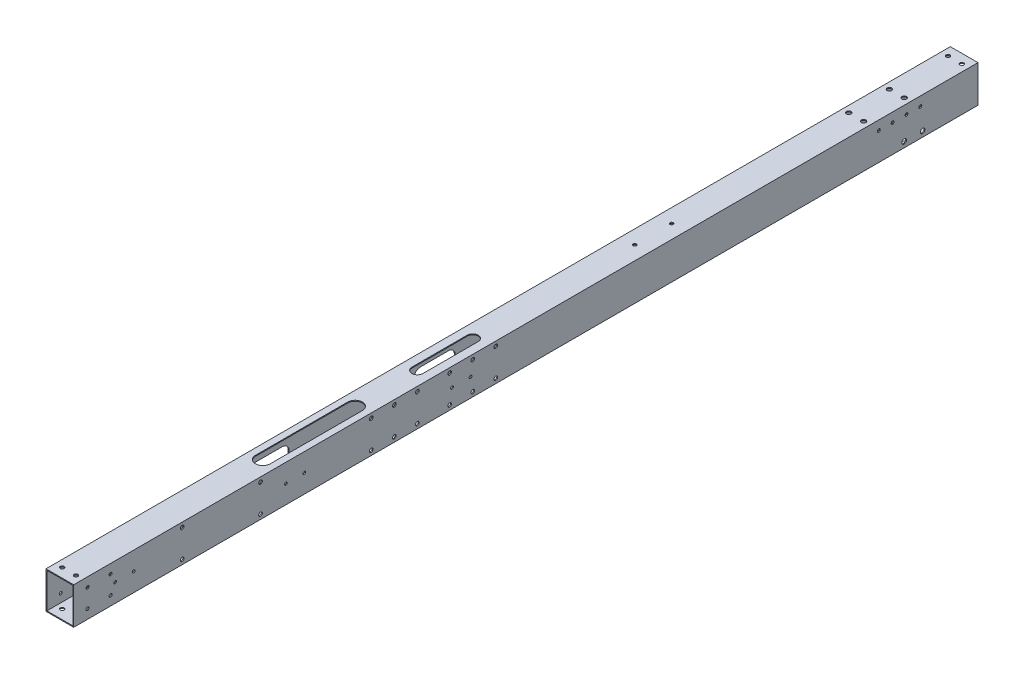
from build123d import *

# Parameters (mm, degrees)
SKETCH_1_W           = 30
SKETCH_1_H           = 40
SKETCH_1_W_2         = 28
SKETCH_1_H_2         = 38
EXTRUDE_1_DEPTH      = 940
SKETCH_5_R           = 2.5
CUT_EXTRUDE_3_DEPTH  = 941.97024395
CUT_EXTRUDE_4_DEPTH  = 1
SKETCH_7_R           = 1.5
CUT_EXTRUDE_5_DEPTH  = 1
SKETCH_17_W          = 30
SKETCH_17_H          = 40
SKETCH_17_W_2        = 28
SKETCH_17_H_2        = 38
EXTRUDE_2_DEPTH      = 20
SKETCH_18_W          = 30
SKETCH_18_H          = 40
SKETCH_18_W_2        = 28
SKETCH_18_H_2        = 38
EXTRUDE_3_DEPTH      = 20
SKETCH_19_R          = 2.1
CUT_EXTRUDE_16_DEPTH = 961.950050731
SKETCH_20_R          = 1.6
CUT_EXTRUDE_17_DEPTH = 961.67684473
SKETCH_21_R          = 2.5
SKETCH_21_R_2        = 1.6
CUT_EXTRUDE_18_DEPTH = 961.67684473
SKETCH_23_R          = 2.5
CUT_EXTRUDE_19_DEPTH = 961.950050731
SKETCH_24_R          = 4.5
CUT_EXTRUDE_20_DEPTH = 10
SKETCH_25_W          = 114.67616049
SKETCH_25_H          = 1154.562704257
CUT_EXTRUDE_21_DEPTH = 968.690549711
SKETCH_26_R          = 2
CUT_EXTRUDE_22_DEPTH = 961.67684473
CUT_EXTRUDE_23_DEPTH = 10
SKETCH_28_R          = 1.5
CUT_EXTRUDE_24_DEPTH = 10
SKETCH_29_R          = 1.5
CUT_EXTRUDE_25_DEPTH = 10
CUT_EXTRUDE_26_DEPTH = 10
SKETCH_31_R          = 1.75
CUT_EXTRUDE_27_DEPTH = 10
SKETCH_34_W          = 70
SKETCH_34_H          = 15
CUT_EXTRUDE_28_DEPTH = 10
EXTRUDE_4_DEPTH      = 1
SKETCH_36_W          = 50.706907747
SKETCH_36_H          = 15.381529857
EXTRUDE_5_DEPTH      = 1
FILLET_1_R           = 3
SKETCH_37_R          = 1.75
CUT_EXTRUDE_29_DEPTH = 81


with BuildPart() as part:
    # 草图1 → 凸台-拉伸1 (new body)
    with BuildSketch(Plane.XY):
        Rectangle(SKETCH_1_W, SKETCH_1_H)
        Rectangle(SKETCH_1_W_2, SKETCH_1_H_2, mode=Mode.SUBTRACT)
    extrude(amount=EXTRUDE_1_DEPTH)

    # 草图5 → 切除-拉伸3 (cut, through all)
    with BuildSketch(Plane.XZ.offset(20)):
        with Locations((-8, 53)):
            Circle(SKETCH_5_R)
        with Locations((8, 53)):
            Circle(SKETCH_5_R)
        with Locations((-8, 97)):
            Circle(SKETCH_5_R)
        with Locations((8, 97)):
            Circle(SKETCH_5_R)
    extrude(amount=-CUT_EXTRUDE_3_DEPTH, mode=Mode.SUBTRACT)

    # 草图6 → 切除-拉伸4 (cut)
    with BuildSketch(Plane(origin=(15, 0, 0), x_dir=(0, 0, -1), z_dir=(1, 0, 0))):
        with BuildLine():
            Line((-345, -7.5), (-375, -7.5))
            ThreePointArc((-375, -7.5), (-382.5, 0), (-375, 7.5))
            Line((-375, 7.5), (-345, 7.5))
            ThreePointArc((-345, 7.5), (-337.5, 0), (-345, -7.5))
        make_face()
        with BuildLine():
            Line((-525, -7.5), (-555, -7.5))
            ThreePointArc((-555, -7.5), (-562.5, 0), (-555, 7.5))
            Line((-555, 7.5), (-525, 7.5))
            ThreePointArc((-525, 7.5), (-517.5, 0), (-525, -7.5))
        make_face()
        with BuildLine():
            Line((-705, -7.5), (-735, -7.5))
            ThreePointArc((-735, -7.5), (-742.5, 0), (-735, 7.5))
            Line((-735, 7.5), (-705, 7.5))
            ThreePointArc((-705, 7.5), (-697.5, 0), (-705, -7.5))
        make_face()
    extrude(amount=-CUT_EXTRUDE_4_DEPTH, mode=Mode.SUBTRACT)

    # 草图7 → 切除-拉伸5 (cut)
    with BuildSketch(Plane.ZY.offset(15)):
        with Locations((350, 0)):
            Circle(SKETCH_7_R)
        with Locations((370, 0)):
            Circle(SKETCH_7_R)
        with Locations((530, 0)):
            Circle(SKETCH_7_R)
        with Locations((550, 0)):
            Circle(SKETCH_7_R)
        with Locations((710, 0)):
            Circle(SKETCH_7_R)
        with Locations((730, 0)):
            Circle(SKETCH_7_R)
    extrude(amount=-CUT_EXTRUDE_5_DEPTH, mode=Mode.SUBTRACT)

    # 草图17 → 凸台-拉伸2 (add)
    with BuildSketch(Plane.XY.offset(940)):
        Rectangle(SKETCH_17_W, SKETCH_17_H)
        Rectangle(SKETCH_17_W_2, SKETCH_17_H_2, mode=Mode.SUBTRACT)
    extrude(amount=EXTRUDE_2_DEPTH)

    # 草图18 → 凸台-拉伸3 (add)
    with BuildSketch(Plane(origin=(0, 0, 0), x_dir=(-1, 0, 0), z_dir=(0, 0, -1))):
        Rectangle(SKETCH_18_W, SKETCH_18_H)
        Rectangle(SKETCH_18_W_2, SKETCH_18_H_2, mode=Mode.SUBTRACT)
    extrude(amount=EXTRUDE_3_DEPTH)

    # 草图19 → 切除-拉伸16 (cut, through all)
    with BuildSketch(Plane(origin=(0, 20, 0), x_dir=(1, 0, 0), z_dir=(0, 1, 0))):
        with Locations((-7.5, -950)):
            Circle(SKETCH_19_R)
        with Locations((7.5, -950)):
            Circle(SKETCH_19_R)
        with Locations((-7.5, 10)):
            Circle(SKETCH_19_R)
        with Locations((7.5, 10)):
            Circle(SKETCH_19_R)
    extrude(amount=-CUT_EXTRUDE_16_DEPTH, mode=Mode.SUBTRACT)

    # 草图20 → 切除-拉伸17 (cut, through all)
    with BuildSketch(Plane(origin=(15, 0, 0), x_dir=(0, 0, -1), z_dir=(1, 0, 0))):
        with Locations((-945, 10)):
            Circle(SKETCH_20_R)
        with Locations((-920, 10)):
            Circle(SKETCH_20_R)
        with Locations((-920, -10)):
            Circle(SKETCH_20_R)
        with Locations((-945, -10)):
            Circle(SKETCH_20_R)
    extrude(amount=-CUT_EXTRUDE_17_DEPTH, mode=Mode.SUBTRACT)

    # 草图21 → 切除-拉伸18 (cut, through all)
    with BuildSketch(Plane(origin=(15, 0, 0), x_dir=(0, 0, -1), z_dir=(1, 0, 0))):
        with Locations((-40, -14)):
            Circle(SKETCH_21_R)
        with Locations((-60, -14)):
            Circle(SKETCH_21_R)
        with Locations((-42.5, 10)):
            Circle(SKETCH_21_R_2)
        with Locations((-57.5, 10)):
            Circle(SKETCH_21_R_2)
        with Locations((-72.5, 10)):
            Circle(SKETCH_21_R_2)
        with Locations((-87.5, 10)):
            Circle(SKETCH_21_R_2)
    extrude(amount=-CUT_EXTRUDE_18_DEPTH, mode=Mode.SUBTRACT)

    # 草图23 → 切除-拉伸19 (cut, through all)
    with BuildSketch(Plane(origin=(0, 20, 0), x_dir=(1, 0, 0), z_dir=(0, 1, 0))):
        with Locations((0, -520)):
            Circle(SKETCH_23_R)
        with Locations((0, -535)):
            Circle(SKETCH_23_R)
        with Locations((0, -550)):
            Circle(SKETCH_23_R)
        with Locations((0, -565)):
            Circle(SKETCH_23_R)
    extrude(amount=-CUT_EXTRUDE_19_DEPTH, mode=Mode.SUBTRACT)

    # 草图24 → 切除-拉伸20 (cut)
    with BuildSketch(Plane(origin=(0, 20, 0), x_dir=(1, 0, 0), z_dir=(0, 1, 0))):
        with Locations((0, -520)):
            Circle(SKETCH_24_R)
        with Locations((0, -535)):
            Circle(SKETCH_24_R)
        with Locations((0, -550)):
            Circle(SKETCH_24_R)
        with Locations((0, -565)):
            Circle(SKETCH_24_R)
    extrude(amount=-CUT_EXTRUDE_20_DEPTH, mode=Mode.SUBTRACT)


with BuildPart() as body_2:
    # 镜向2: mirrored copy
    add(part.part.mirror(Plane(origin=(-50, 0, 0), x_dir=(0, 0, 1), z_dir=(1, 0, 0))))

    # 草图26 → 切除-拉伸22 (cut, through all)
    with BuildSketch(Plane.ZY.offset(115)):
        with Locations((612.5, 15)):
            Circle(SKETCH_26_R)
        with Locations((612.5, -15)):
            Circle(SKETCH_26_R)
        with Locations((527.5, 15)):
            Circle(SKETCH_26_R)
        with Locations((527.5, -15)):
            Circle(SKETCH_26_R)
        with Locations((842.5, 15)):
            Circle(SKETCH_26_R)
        with Locations((842.5, -15)):
            Circle(SKETCH_26_R)
        with Locations((757.5, 15)):
            Circle(SKETCH_26_R)
        with Locations((757.5, -15)):
            Circle(SKETCH_26_R)
        with Locations((637.5, 15)):
            Circle(SKETCH_26_R)
        with Locations((637.5, -15)):
            Circle(SKETCH_26_R)
        with Locations((552.5, -15)):
            Circle(SKETCH_26_R)
        with Locations((552.5, 15)):
            Circle(SKETCH_26_R)
        with Locations((502.5, 15)):
            Circle(SKETCH_26_R)
        with Locations((502.5, -15)):
            Circle(SKETCH_26_R)
        with Locations((587.5, -15)):
            Circle(SKETCH_26_R)
        with Locations((587.5, 15)):
            Circle(SKETCH_26_R)
    extrude(amount=-CUT_EXTRUDE_22_DEPTH, mode=Mode.SUBTRACT)

    # 草图27 → 切除-拉伸23 (cut)
    with BuildSketch(Plane(origin=(0, 20, 0), x_dir=(1, 0, 0), z_dir=(0, 1, 0))):
        with BuildLine():
            Line((-94, -512.5), (-94, -572.5))
            ThreePointArc((-94, -572.5), (-100, -578.5), (-106, -572.5))
            Line((-106, -572.5), (-106, -512.5))
            ThreePointArc((-106, -512.5), (-100, -506.5), (-94, -512.5))
        make_face()
    extrude(amount=-CUT_EXTRUDE_23_DEPTH, mode=Mode.SUBTRACT)

    # 草图28 → 切除-拉伸24 (cut)
    with BuildSketch(Plane(origin=(-85, 0, 0), x_dir=(0, 0, -1), z_dir=(1, 0, 0))):
        with Locations((-730, 0)):
            Circle(SKETCH_28_R)
        with Locations((-710, 0)):
            Circle(SKETCH_28_R)
        with Locations((-915, 0)):
            Circle(SKETCH_28_R)
        with Locations((-895, 0)):
            Circle(SKETCH_28_R)
    extrude(amount=-CUT_EXTRUDE_24_DEPTH, mode=Mode.SUBTRACT)

    # 草图29 → 切除-拉伸25 (cut)
    with BuildSketch(Plane.XZ.offset(20)):
        with Locations((-105, 740)):
            Circle(SKETCH_29_R)
        with Locations((-105, 720)):
            Circle(SKETCH_29_R)
        with Locations((-105, 700)):
            Circle(SKETCH_29_R)
        with Locations((-105, 680)):
            Circle(SKETCH_29_R)
        with Locations((-105, 660)):
            Circle(SKETCH_29_R)
        with Locations((-105, 640)):
            Circle(SKETCH_29_R)
        with Locations((-105, 620)):
            Circle(SKETCH_29_R)
    extrude(amount=-CUT_EXTRUDE_25_DEPTH, mode=Mode.SUBTRACT)

    # 草图30 → 切除-拉伸26 (cut)
    with BuildSketch(Plane(origin=(0, 20, 0), x_dir=(1, 0, 0), z_dir=(0, 1, 0))):
        with BuildLine():
            Line((-92, -640), (-92, -740))
            ThreePointArc((-92, -740), (-100, -748), (-108, -740))
            Line((-108, -740), (-108, -640))
            ThreePointArc((-108, -640), (-100, -632), (-92, -640))
        make_face()
    extrude(amount=-CUT_EXTRUDE_26_DEPTH, mode=Mode.SUBTRACT)

    # 草图31 → 切除-拉伸27 (cut)
    with BuildSketch(Plane.XZ.offset(20)):
        with Locations((-100, 137)):
            Circle(SKETCH_31_R)
        with Locations((-100, 177)):
            Circle(SKETCH_31_R)
    extrude(amount=-CUT_EXTRUDE_27_DEPTH, mode=Mode.SUBTRACT)

    # 草图34 → 切除-拉伸28 (cut)
    with BuildSketch(Plane.ZY.offset(115)):
        with Locations((315, -11.5)):
            Rectangle(SKETCH_34_W, SKETCH_34_H)
    extrude(amount=-CUT_EXTRUDE_28_DEPTH, mode=Mode.SUBTRACT)

    # 草图35 → 凸台-拉伸4 (add)
    with BuildSketch(Plane.ZY.offset(115)):
        Polygon((336.145770334, -4), (350, -4), (350, -9.077366936), (391.920925018, -9.077366936), (391.920925018, 11.093373936), (336.145770334, 11.093373936), align=None)
    extrude(amount=-EXTRUDE_4_DEPTH)

    # 草图36 → 凸台-拉伸5 (add)
    with BuildSketch(Plane(origin=(-85, 0, 0), x_dir=(0, 0, -1), z_dir=(1, 0, 0))):
        with Locations((-354.422343157, -1.974054468)):
            Rectangle(SKETCH_36_W, SKETCH_36_H)
    extrude(amount=-EXTRUDE_5_DEPTH)

    # 圆角1
    fillet_1_edges = [body_2.edges().sort_by_distance(p)[0] for p in [
        (-114.5, -19, 350),
        (-114.5, -4, 350),
        (-114.5, -4, 280),
        (-114.5, -19, 280),
    ]]
    fillet(fillet_1_edges, radius=FILLET_1_R)

    # 草图37 → 切除-拉伸29 (cut)
    with BuildSketch(Plane.XZ.offset(20)):
        with Locations((-100, 297)):
            Circle(SKETCH_37_R)
        with Locations((-100, 337)):
            Circle(SKETCH_37_R)
    extrude(amount=-CUT_EXTRUDE_29_DEPTH, mode=Mode.SUBTRACT)


with BuildPart() as part_1:
    add(part.part)

    # 草图25 → 切除-拉伸21 (cut, through all)
    with BuildSketch(Plane(origin=(0, 20, 0), x_dir=(1, 0, 0), z_dir=(0, 1, 0))):
        with Locations((7.338080245, -506.215166959)):
            Rectangle(SKETCH_25_W, SKETCH_25_H)
    extrude(amount=-CUT_EXTRUDE_21_DEPTH, mode=Mode.SUBTRACT)


solid = body_2.part
